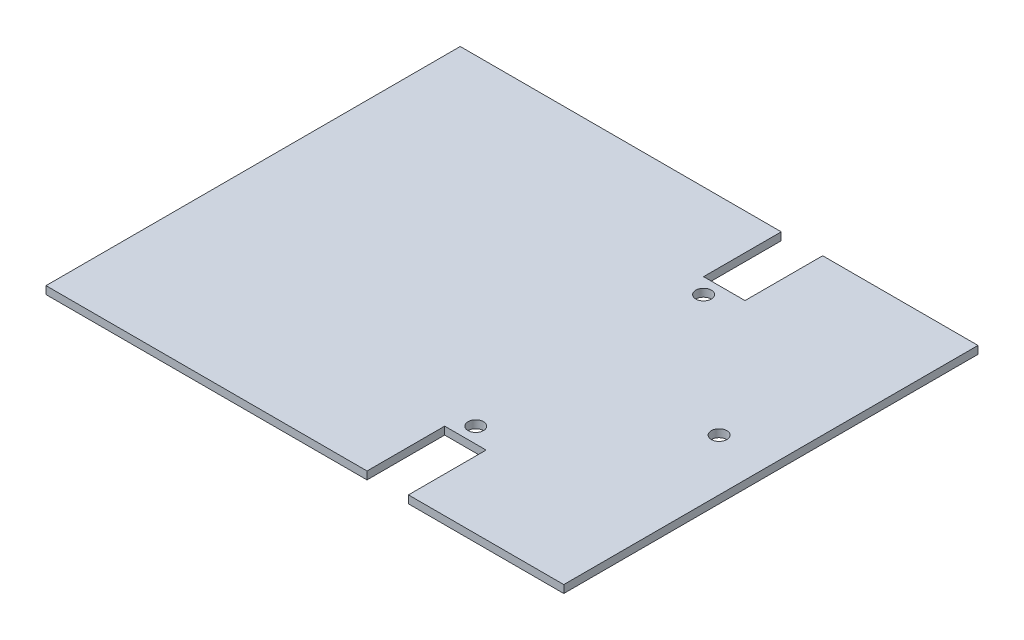
from build123d import *

# Parameters (mm, degrees)
SKETCH1_W           = 100
SKETCH1_H           = 80
BOSS_EXTRUDE1_DEPTH = 1.5
CUT_EXTRUDE1_REACH  = 130.071
SKETCH2_W           = 8
SKETCH2_H           = 15
CUT_EXTRUDE2_REACH  = 130.071
SKETCH3_R           = 1.5


with BuildPart() as part:
    # Sketch1 → Boss-Extrude1 (new body)
    with BuildSketch(Plane(origin=(0, 0, 0), x_dir=(1, 0, 0), z_dir=(0, 1, 0))):
        with Locations((50, 40)):
            Rectangle(SKETCH1_W, SKETCH1_H)
    extrude(amount=BOSS_EXTRUDE1_DEPTH)

    # Sketch2 → Cut-Extrude1 (cut, up to next)
    with BuildSketch(Plane(origin=(0, 1.5, 0), x_dir=(1, 0, 0), z_dir=(0, 1, 0)), mode=Mode.PRIVATE) as cut_extrude1_sk1:
        with Locations((66, 72.5)):
            Rectangle(SKETCH2_W, SKETCH2_H)
    cut_extrude1_tool1 = extrude(cut_extrude1_sk1.sketch, amount=-CUT_EXTRUDE1_REACH, mode=Mode.PRIVATE) & part.part
    # Sketch2 → Cut-Extrude1 (cut, up to next)
    with BuildSketch(Plane(origin=(0, 1.5, 0), x_dir=(1, 0, 0), z_dir=(0, 1, 0)), mode=Mode.PRIVATE) as cut_extrude1_sk2:
        with Locations((66, 7.5)):
            Rectangle(SKETCH2_W, SKETCH2_H)
    cut_extrude1_tool2 = extrude(cut_extrude1_sk2.sketch, amount=-CUT_EXTRUDE1_REACH, mode=Mode.PRIVATE) & part.part
    add(cut_extrude1_tool1.solids().sort_by_distance((66, 1.5, -72.5))[0], mode=Mode.SUBTRACT)
    add(cut_extrude1_tool2.solids().sort_by_distance((66, 1.5, -7.5))[0], mode=Mode.SUBTRACT)

    # Sketch3 → Cut-Extrude2 (cut, up to next)
    with BuildSketch(Plane(origin=(0, 1.5, 0), x_dir=(1, 0, 0), z_dir=(0, 1, 0)), mode=Mode.PRIVATE) as cut_extrude2_sk1:
        with Locations((65, 62)):
            Circle(SKETCH3_R)
    cut_extrude2_tool1 = extrude(cut_extrude2_sk1.sketch, amount=-CUT_EXTRUDE2_REACH, mode=Mode.PRIVATE) & part.part
    # Sketch3 → Cut-Extrude2 (cut, up to next)
    with BuildSketch(Plane(origin=(0, 1.5, 0), x_dir=(1, 0, 0), z_dir=(0, 1, 0)), mode=Mode.PRIVATE) as cut_extrude2_sk2:
        with Locations((90, 40)):
            Circle(SKETCH3_R)
    cut_extrude2_tool2 = extrude(cut_extrude2_sk2.sketch, amount=-CUT_EXTRUDE2_REACH, mode=Mode.PRIVATE) & part.part
    # Sketch3 → Cut-Extrude2 (cut, up to next)
    with BuildSketch(Plane(origin=(0, 1.5, 0), x_dir=(1, 0, 0), z_dir=(0, 1, 0)), mode=Mode.PRIVATE) as cut_extrude2_sk3:
        with Locations((65, 18)):
            Circle(SKETCH3_R)
    cut_extrude2_tool3 = extrude(cut_extrude2_sk3.sketch, amount=-CUT_EXTRUDE2_REACH, mode=Mode.PRIVATE) & part.part
    add(cut_extrude2_tool1.solids().sort_by_distance((65, 1.5, -62))[0], mode=Mode.SUBTRACT)
    add(cut_extrude2_tool2.solids().sort_by_distance((90, 1.5, -40))[0], mode=Mode.SUBTRACT)
    add(cut_extrude2_tool3.solids().sort_by_distance((65, 1.5, -18))[0], mode=Mode.SUBTRACT)


solid = part.part
